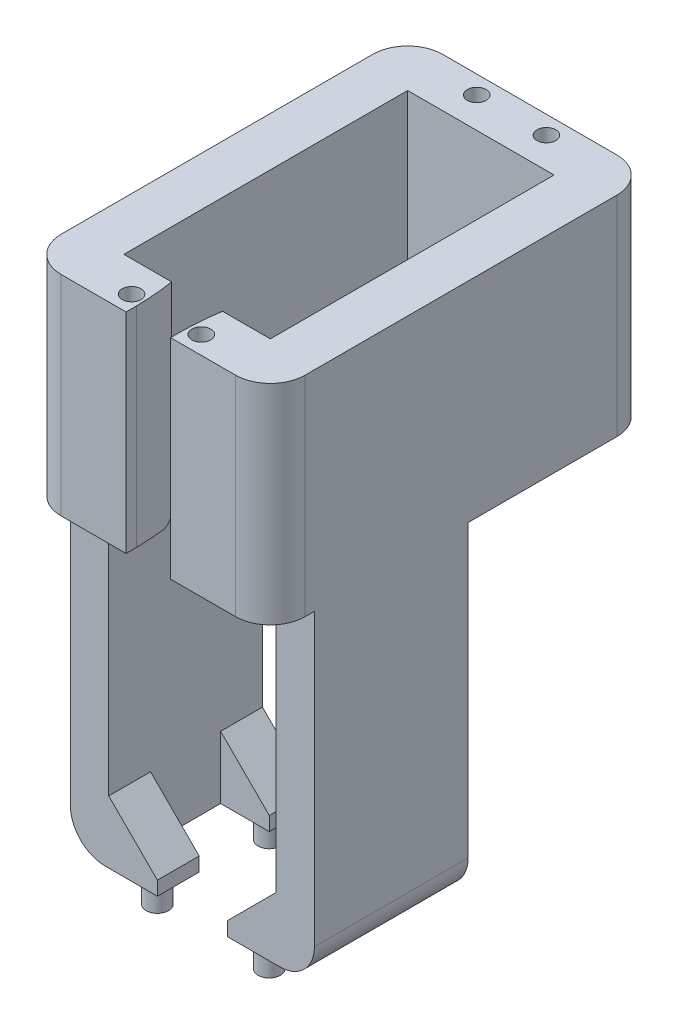
from build123d import *

# Parameters (mm, degrees)
SKETCH2_W           = 35
SKETCH2_H           = 54.7
SKETCH2_R           = 1.35
SKETCH2_W_2         = 21
SKETCH2_H_2         = 40.7
BOSS_EXTRUDE1_DEPTH = 30
CUT_EXTRUDE2_REACH  = 46.207
BORDES_SERVO_R      = 1.5
ALTURA_TORRES_DEPTH = 46.65665
BOSS_EXTRUDE3_START = 46.65665
SKETCH5_3_W         = 6.975
SKETCH5_3_H         = 6
BOSS_EXTRUDE3_DEPTH = 2
CHAMFER1_SIZE       = 6.975
BOSS_EXTRUDE4_START = 46.65665
SKETCH5_4_R         = 1.6
BOSS_EXTRUDE4_DEPTH = 4
BORDES_EXT_R        = 5


with BuildPart() as part:
    # Sketch2 → Boss-Extrude1 (new body)
    with BuildSketch(Plane(origin=(0, 0, 0), x_dir=(1, 0, 0), z_dir=(0, 1, 0))):
        Rectangle(SKETCH2_W, SKETCH2_H)
        with Locations(Location((-5, 24.75, 0), (0, 0, 270))):
            Circle(SKETCH2_R, mode=Mode.SUBTRACT)
        with Locations(Location((5, 24.75, 0), (0, 0, 90))):
            Circle(SKETCH2_R, mode=Mode.SUBTRACT)
        with Locations(Location((-5, -24.75, 0), (0, 0, 90))):
            Circle(SKETCH2_R, mode=Mode.SUBTRACT)
        with Locations(Location((5, -24.75, 0), (0, 0, 270))):
            Circle(SKETCH2_R, mode=Mode.SUBTRACT)
        Rectangle(SKETCH2_W_2, SKETCH2_H_2, mode=Mode.SUBTRACT)
    extrude(amount=-BOSS_EXTRUDE1_DEPTH)

    # Sketch4 → Cut-Extrude2 (cut, up to next)
    with BuildSketch(Plane(origin=(0, 0, 0), x_dir=(1, 0, 0), z_dir=(0, 1, 0)), mode=Mode.PRIVATE) as cut_extrude2_sk1:
        with BuildLine():
            Line((-3.199984377, -25.852499805), (-3.181265624, -27.35))
            Line((-3.181265624, -27.35), (3.181265624, -27.35))
            Line((3.181265624, -27.35), (3.199984377, -25.852499805))
            ThreePointArc((3.199984377, -25.852499805), (3.329330747, -23.093556632), (3.647756443, -20.35))
            Line((3.647756443, -20.35), (-3.647756443, -20.35))
            ThreePointArc((-3.647756443, -20.35), (-3.329330747, -23.093556632), (-3.199984377, -25.852499805))
        make_face()
    cut_extrude2_tool1 = extrude(cut_extrude2_sk1.sketch, amount=-CUT_EXTRUDE2_REACH, mode=Mode.PRIVATE) & part.part
    add(cut_extrude2_tool1.solids().sort_by_distance((0, 0, 23.771279))[0], mode=Mode.SUBTRACT)

    # Bordes_Servo
    bordes_servo_edges = [part.edges().sort_by_distance(p)[0] for p in [
        (10.5, -30, 0),
        (-7.073878222, -30, 20.35),
        (-10.5, -30, 0),
        (0, -30, -20.35),
        (7.073878222, -30, 20.35),
    ]]
    fillet(bordes_servo_edges, radius=BORDES_SERVO_R)

    # Sketch5 → Altura torres (add)
    with BuildSketch(Plane.XZ.offset(30)):
        Polygon((-12, 21.025), (-17.5, 21.025), (-17.5, -1.025), (-12, -1.025), (-12, 4.975), (-12, 15.025), align=None)
        Polygon((12, 4.975), (12, -1.025), (17.5, -1.025), (17.5, 21.025), (12, 21.025), (12, 15.025), align=None)
    extrude(amount=ALTURA_TORRES_DEPTH)

    # Sketch5<3> → Boss-Extrude3 (add)
    with BuildSketch(Plane.XZ.offset(30).offset(BOSS_EXTRUDE3_START)):
        with Locations((-8.5125, 18.025)):
            Rectangle(SKETCH5_3_W, SKETCH5_3_H)
        with Locations((-8.5125, 1.975)):
            Rectangle(SKETCH5_3_W, SKETCH5_3_H)
        with Locations((8.5125, 1.975)):
            Rectangle(SKETCH5_3_W, SKETCH5_3_H)
        with Locations((8.5125, 18.025)):
            Rectangle(SKETCH5_3_W, SKETCH5_3_H)
    extrude(amount=-BOSS_EXTRUDE3_DEPTH)

    # Chamfer1
    chamfer1_edges = [part.edges().sort_by_distance(p)[0] for p in [
        (12, -74.65665, 18.025),
        (12, -74.65665, 1.975),
        (-12, -74.65665, 18.025),
        (-12, -74.65665, 1.975),
    ]]
    chamfer(chamfer1_edges, length=CHAMFER1_SIZE - 0.0001)  # a hair under: the kernel refuses the full size

    # Sketch5<4> → Boss-Extrude4 (add)
    with BuildSketch(Plane.XZ.offset(30).offset(BOSS_EXTRUDE4_START)):
        with Locations(Location((8.025, 1.975, 0), (0, 0, 270))):
            Circle(SKETCH5_4_R)
        with Locations(Location((-8.025, 1.975, 0), (0, 0, 270))):
            Circle(SKETCH5_4_R)
        with Locations(Location((-8.025, 18.025, 0), (0, 0, 270))):
            Circle(SKETCH5_4_R)
        with Locations(Location((8.025, 18.025, 0), (0, 0, 270))):
            Circle(SKETCH5_4_R)
    extrude(amount=BOSS_EXTRUDE4_DEPTH)

    # Bordes_Ext
    bordes_ext_edges = [part.edges().sort_by_distance(p)[0] for p in [
        (17.5, -76.65665, 10),
        (17.5, -15, -27.35),
        (17.5, -15, 27.35),
        (-17.5, -15, 27.35),
        (-17.5, -15, -27.35),
        (-17.5, -76.65665, 10),
    ]]
    fillet(bordes_ext_edges, radius=BORDES_EXT_R)


solid = part.part
